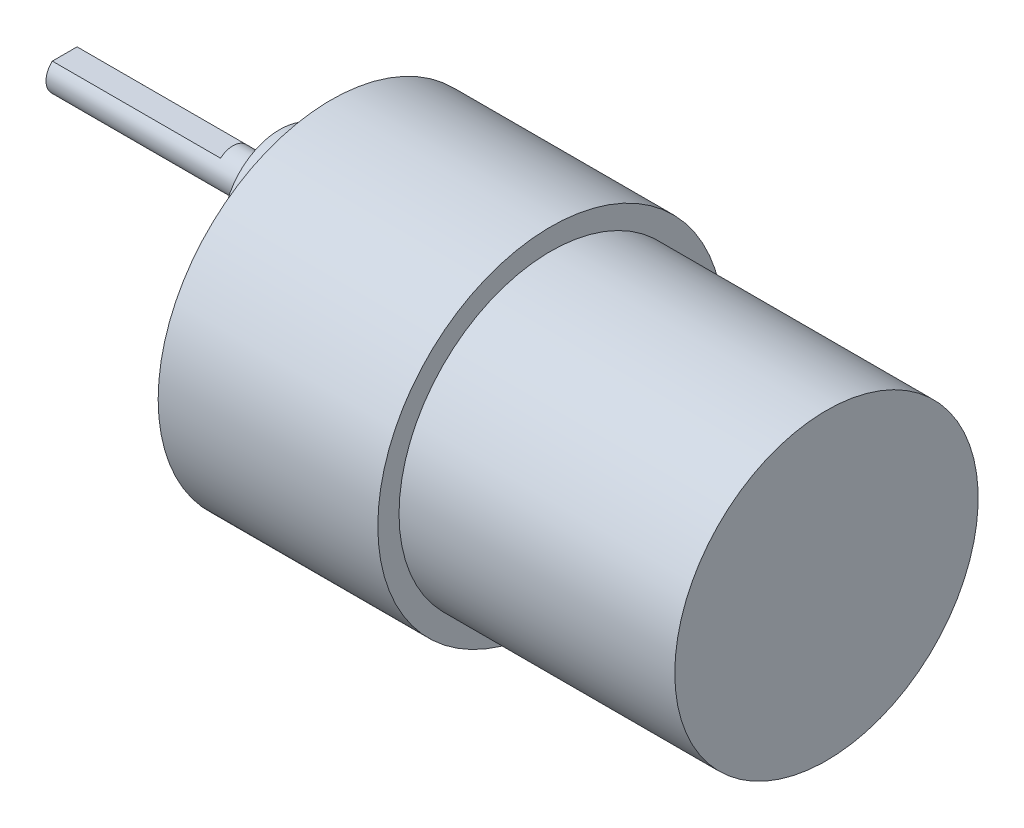
from build123d import *

# Parameters (mm, degrees)
M3_5X0_6_TAPPED_HOLE1_D     = 2.9
M3_5X0_6_TAPPED_HOLE1_DEPTH = 3.5
M3_5X0_6_TAPPED_HOLE1_TIP   = 0.871247898
SKETCH6_R                   = 6
BOSS_EXTRUDE1_DEPTH         = 5.5
SKETCH7_R                   = 2
BOSS_EXTRUDE2_DEPTH         = 23
CUT_EXTRUDE1_START          = -18
CUT_EXTRUDE1_DEPTH          = 18


with BuildPart() as part:
    # Sketch1 → Revolve1 (revolve)
    with BuildSketch(Plane.XY):
        Polygon((0, 18.499999957), (0, 0), (53, 0), (53, 16.23), (23.5, 16.23), (23.5, 18.499999957), align=None)
    revolve(axis=Axis((0, 0, 0), (1, 0, 0)))

    # M3.5x0.6 Tapped Hole1
    with Locations(Plane.ZY):
        with Locations((7.75, 13.423393759), (15.5, 0), (7.75, -13.423393759), (-7.75, -13.423393759), (-15.5, 0), (-7.75, 13.423393759)):
            Hole(M3_5X0_6_TAPPED_HOLE1_D / 2, depth=M3_5X0_6_TAPPED_HOLE1_DEPTH)
            with Locations((0, 0, -(M3_5X0_6_TAPPED_HOLE1_DEPTH + M3_5X0_6_TAPPED_HOLE1_TIP / 2))):  # 118° drill point
                Cone(0, M3_5X0_6_TAPPED_HOLE1_D / 2, M3_5X0_6_TAPPED_HOLE1_TIP, mode=Mode.SUBTRACT)

    # Sketch6 → Boss-Extrude1 (add)
    with BuildSketch(Plane.ZY):
        with Locations((0, 7)):
            Circle(SKETCH6_R)
    extrude(amount=BOSS_EXTRUDE1_DEPTH)

    # Sketch7 → Boss-Extrude2 (add)
    with BuildSketch(Plane.ZY.offset(5.5)):
        with Locations((0, 7)):
            Circle(SKETCH7_R)
    extrude(amount=BOSS_EXTRUDE2_DEPTH)

    # Sketch8 → Cut-Extrude1 (cut)
    with BuildSketch(Plane.ZY.offset(28.5).offset(CUT_EXTRUDE1_START)):
        with BuildLine():
            ThreePointArc((1.322875656, 8.5), (0, 9), (-1.322875656, 8.5))
            Line((-1.322875656, 8.5), (1.322875656, 8.5))
        make_face()
    extrude(amount=CUT_EXTRUDE1_DEPTH, mode=Mode.SUBTRACT)


solid = part.part
